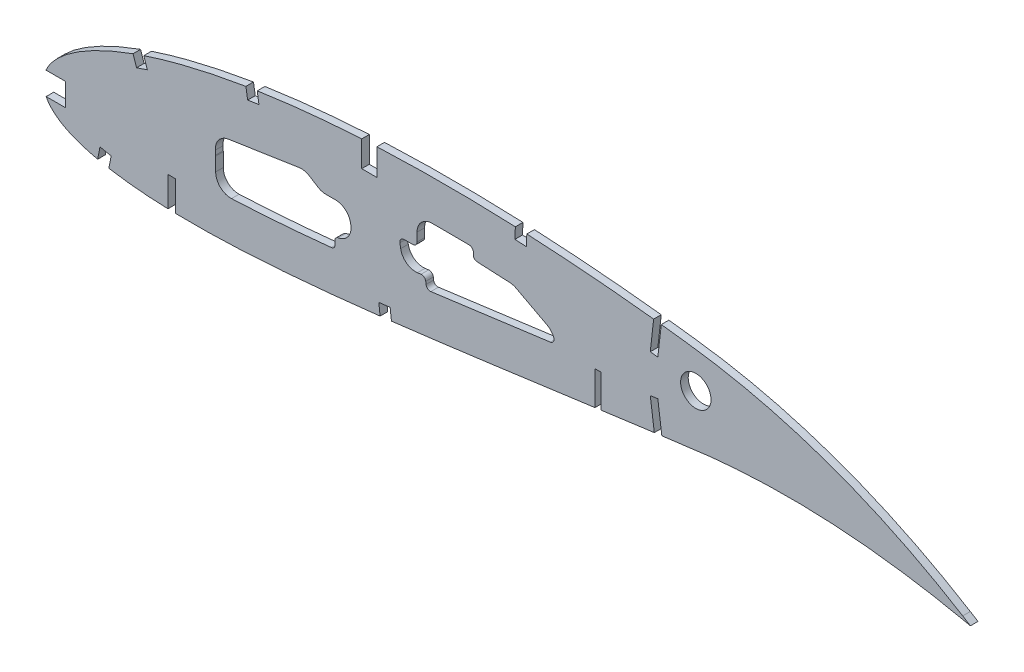
from build123d import *

# Parameters (mm, degrees)
BOSS_EXTRUDE1_DEPTH = 3.175
CUT_EXTRUDE1_DEPTH  = 7.62
SKETCH3_R           = 6.35
CUT_EXTRUDE2_DEPTH  = 7.62
SKETCH4_W           = 9.525
SKETCH4_H           = 9.525
CUT_EXTRUDE3_DEPTH  = 391.201801695
CUT_EXTRUDE4_DEPTH  = 7.62
FILLET1_START       = -1
FILLET1_DEPTH       = 5
FILLET1_2_DEPTH     = 3.175
FILLET2_R           = 1.778


with BuildPart() as part:
    # Sketch1 → Boss-Extrude1 (new body)
    with BuildSketch(Plane.XY):
        with BuildLine():
            Line((383.459719795, -0.598570683), (387.151098381, -1.385981683))
            Line((387.151098381, -1.385981683), (383.938576586, 0.598570683))
            add(Edge.make_bspline(
                [(383.938576586, 0.598570683), (383.909164402, 0.616740215), (383.791629853, 0.689347806), (383.526803342, 0.851788775), (383.085812234, 1.122342517), (382.46846306, 1.499129399), (381.675235414, 1.981149322), (380.705730092, 2.565026812), (379.560552258, 3.248864764), (378.239979352, 4.02942936), (376.744146546, 4.903065392), (375.073623444, 5.866233811), (373.228555337, 6.913481558), (371.209656947, 8.040529653), (369.017620878, 9.242017712), (366.652862008, 10.5125194), (364.116227136, 11.845572217), (361.408689747, 13.235442203), (358.530743662, 14.674454529), (355.483745734, 16.156620323), (352.268711027, 17.674549225), (348.886737002, 19.220143157), (345.339766501, 20.787101279), (341.62878015, 22.365681942), (337.755892849, 23.949045726), (333.722753433, 25.528181676), (329.531749722, 27.095897536), (325.184498663, 28.642037582), (320.684250026, 30.159844956), (316.03318694, 31.639459621), (311.234635387, 33.072845765), (306.291383411, 34.45071), (301.207551835, 35.76598594), (295.986364862, 37.009095199), (290.632247735, 38.171716814), (285.149456354, 39.246851106), (279.542589067, 40.223764407), (273.827182957, 41.101695037), (268.095197614, 41.831984573), (262.375005403, 42.548231339), (256.663331957, 43.221079634), (250.881849899, 43.865424929), (245.036121341, 44.477639467), (239.131944816, 45.055808842), (233.175297421, 45.597437688), (227.172369204, 46.100937725), (221.12896887, 46.563455864), (215.051468851, 46.984279591), (208.945877574, 47.359709224), (202.818698224, 47.689463037), (196.676150699, 47.971241104), (190.524627328, 48.20310193), (184.370660154, 48.383645908), (178.220637202, 48.511143259), (172.081217377, 48.584792389), (165.95878665, 48.602580967), (159.860000816, 48.564190717), (153.791246295, 48.468303513), (147.759185686, 48.313606629), (141.770214134, 48.099811437), (135.830807778, 47.827010592), (129.947469668, 47.492919603), (124.126582163, 47.099667535), (118.374627308, 46.64560247), (112.697924861, 46.1306036), (107.102424066, 45.556817635), (101.594354639, 44.922683996), (96.179619551, 44.23000695), (90.864141437, 43.480144639), (85.653884398, 42.672688505), (80.554429795, 41.809970933), (75.571281385, 40.892874577), (70.709711341, 39.924088059), (65.975012599, 38.903864189), (61.372197101, 37.835263284), (56.906048373, 36.72014713), (52.581367423, 35.560557176), (48.402538226, 34.359275924), (44.373786491, 33.11902871), (40.499808771, 31.84117832), (36.783532955, 30.530569775), (33.229524089, 29.188133497), (29.840504666, 27.818005118), (26.620446377, 26.422055375), (23.571754691, 25.004539962), (20.697880073, 23.567072571), (18.000870717, 22.113680535), (15.483434196, 20.646592482), (13.147993867, 19.168533315), (10.995531238, 17.683252327), (9.029014018, 16.191681681), (7.249117676, 14.697590602), (5.656968684, 13.203254087), (4.254842735, 11.709701653), (3.042689485, 10.219563342), (2.022097407, 8.734019375), (1.193243635, 7.254475378), (0.55800286, 5.78200614), (0.115745172, 4.317439731), (-0.126343705, 2.862937809), (-0.186601112, 1.417334332), (-0.062107432, 0.471738862), (0, 0)],
                knots=[0, 0, 0, 0, 0.00025409, 0.001015374, 0.002283359, 0.004056577, 0.006330982, 0.009105274, 0.01237449, 0.016134024, 0.020379661, 0.025105976, 0.030306237, 0.035972206, 0.042099523, 0.048678064, 0.055701664, 0.063160184, 0.071045824, 0.079349827, 0.08806291, 0.097175757, 0.106678112, 0.116561573, 0.126814276, 0.1374283, 0.148393618, 0.15969976, 0.171338126, 0.183297699, 0.195569604, 0.208143556, 0.221011594, 0.234161831, 0.247587451, 0.261276823, 0.27522271, 0.289414144, 0.3037712, 0.317689227, 0.331784111, 0.346039677, 0.36044387, 0.374982721, 0.389640455, 0.404403317, 0.419256601, 0.43418675, 0.449177265, 0.464214782, 0.479284009, 0.49436974, 0.509457833, 0.524532346, 0.53957932, 0.554582984, 0.569529546, 0.584403417, 0.599190992, 0.613876838, 0.628447475, 0.642888675, 0.657186054, 0.671325546, 0.685294014, 0.699078148, 0.712665095, 0.726042645, 0.739197713, 0.752117587, 0.764792042, 0.777208152, 0.789355685, 0.80122396, 0.812803686, 0.824082909, 0.835054602, 0.845709571, 0.856037853, 0.866033835, 0.875688843, 0.884997719, 0.893953426, 0.902552897, 0.910789386, 0.918660734, 0.926166253, 0.933302626, 0.94007122, 0.94647478, 0.952517526, 0.958204819, 0.963546652, 0.9685566, 0.973249913, 0.977651041, 0.981787043, 0.985694226, 0.989415109, 0.993001157, 0.996508416, 1, 1, 1, 1], degree=3))
            add(Edge.make_bspline(
                [(0, 0), (0.098594067, -0.465429756), (0.296235321, -1.398428295), (0.833200827, -2.741559621), (1.543312041, -4.032697891), (2.441472641, -5.268413507), (3.521710628, -6.448368806), (4.781640288, -7.573790979), (6.220025893, -8.64407503), (7.834984953, -9.658733762), (9.624171422, -10.618844355), (11.585574313, -11.523809795), (13.717405168, -12.373347376), (16.017341357, -13.166321391), (18.482571114, -13.903939589), (21.110750633, -14.584404413), (23.898891402, -15.208666937), (26.844311765, -15.775133676), (29.943802121, -16.284380139), (33.194142548, -16.736121271), (36.59199678, -17.130639725), (40.134031288, -17.46710754), (43.816742631, -17.74624851), (47.636460203, -17.96824782), (51.589476278, -18.133809384), (55.672004278, -18.242303834), (59.880045838, -18.295422597), (64.209798061, -18.293963098), (68.657025429, -18.237535039), (73.217928944, -18.129255696), (77.888131918, -17.96843911), (82.663418096, -17.757031491), (87.53948011, -17.497160264), (92.511944666, -17.189706447), (97.576435823, -16.836032634), (102.728556211, -16.438975174), (107.9636256, -15.999524359), (113.277078315, -15.52024171), (118.664210326, -15.003526584), (124.120367239, -14.4510143), (129.640733027, -13.865303885), (135.220390799, -13.248293384), (140.854593983, -12.603274503), (146.538195749, -11.931414237), (152.266389991, -11.236548635), (158.033787934, -10.52000534), (163.835566864, -9.784544171), (169.666508639, -9.033628137), (175.521154495, -8.267171513), (181.394580274, -7.490635069), (187.28112183, -6.703379195), (193.175655329, -5.90945278), (199.072724256, -5.111323575), (204.966584816, -4.309237241), (210.852056119, -3.506517822), (216.72367834, -2.705368887), (222.575700149, -1.905863728), (228.402826975, -1.111976133), (234.199191111, -0.323609112), (239.959447702, 0.457639018), (245.678076832, 1.229436212), (251.34968319, 1.990808513), (256.968416226, 2.741274105), (262.528623029, 3.481114832), (267.941468501, 4.187874758), (273.192808754, 4.89918891), (278.300339848, 5.482308989), (283.344275668, 5.980022849), (288.329855672, 6.388079628), (293.25109327, 6.712349854), (298.102349784, 6.95515067), (302.877843519, 7.119871856), (307.571542288, 7.211400107), (312.17758361, 7.232058132), (316.689680406, 7.188433969), (321.101964205, 7.084044048), (325.408277014, 6.923573954), (329.602611012, 6.712437706), (333.679008651, 6.45639092), (337.631349997, 6.159210609), (341.4541277, 5.827834534), (345.141443703, 5.46711367), (348.687636023, 5.081169316), (352.087530269, 4.678088588), (355.335684636, 4.260525247), (358.42721331, 3.835341496), (361.357139876, 3.406846029), (364.120823945, 2.98050952), (366.713923524, 2.560399127), (369.132249836, 2.152090859), (371.372014685, 1.759399564), (373.429331453, 1.386160167), (375.301346074, 1.037081953), (376.984361404, 0.713898906), (378.476126466, 0.421937235), (379.773867448, 0.162485176), (380.875681878, -0.060801967), (381.779645661, -0.247042835), (382.484385883, -0.393180216), (382.98851051, -0.499447588), (383.291474212, -0.56268208), (383.426084821, -0.591395979), (383.459719795, -0.598570683)],
                knots=[0, 0, 0, 0, 0.003638255, 0.007293231, 0.011028136, 0.014901081, 0.018963272, 0.023258475, 0.027820626, 0.032679082, 0.03785316, 0.043361875, 0.049214679, 0.055422346, 0.061988786, 0.068918036, 0.076211157, 0.083868392, 0.091887411, 0.100265912, 0.108999867, 0.11808453, 0.127514843, 0.13728527, 0.147387918, 0.157816481, 0.168563473, 0.179619128, 0.190977373, 0.202626974, 0.214560478, 0.226767249, 0.239236417, 0.251959004, 0.264923895, 0.278119703, 0.291536035, 0.30516028, 0.318980685, 0.332985499, 0.347162791, 0.361498603, 0.375980747, 0.390597192, 0.405332594, 0.420174823, 0.435109533, 0.450124276, 0.465203068, 0.480333154, 0.495500583, 0.510689775, 0.525887335, 0.541078314, 0.556247233, 0.571381785, 0.586466041, 0.601484516, 0.616424329, 0.631269423, 0.646006524, 0.660620684, 0.675098187, 0.689422858, 0.703581825, 0.716907564, 0.730009274, 0.742952128, 0.755725558, 0.768319952, 0.780724338, 0.792926529, 0.804916041, 0.816679084, 0.828203524, 0.839474901, 0.850481359, 0.861207697, 0.871639326, 0.881763414, 0.891563605, 0.901027365, 0.910138977, 0.918883977, 0.927249278, 0.935221104, 0.942784739, 0.949928188, 0.956638465, 0.962904204, 0.968712288, 0.974054485, 0.978918432, 0.983297218, 0.987180246, 0.990560675, 0.993433358, 0.995790626, 0.997629588, 0.998945816, 0.999736593, 1, 1, 1, 1], degree=3))
        make_face()
    extrude(amount=BOSS_EXTRUDE1_DEPTH)

    # Sketch2 → Cut-Extrude1 (cut)
    with BuildSketch(Plane(origin=(0, 0, 0), x_dir=(-1, 0, 0), z_dir=(0, 0, -1))):
        Polygon((-232.830519521, 13.223759895), (-230.290519521, 13.223759895), (-230.290519521, -0.503150855), (-230.290519521, -1.676443335), (-232.830519521, -2.849735815), (-232.830519521, -0.503150855), align=None)
        Polygon((-139.168019522, 47.908228591), (-139.168019522, 36.867770555), (-132.818019522, 36.867770555), (-132.818019522, 47.908228591), (-132.818019522, 49.167930893), (-139.168019522, 49.448896734), align=None)
        Polygon((-55.030519521, -5.682926751), (-55.030519521, -17.79896551), (-55.030519521, -19.968015046), (-51.855519521, -18.501399447), (-51.855519521, -17.79896551), (-51.855519521, -5.682926751), align=None)
    extrude(amount=-CUT_EXTRUDE1_DEPTH, mode=Mode.SUBTRACT)

    # Sketch3 → Cut-Extrude2 (cut)
    with BuildSketch(Plane(origin=(0, 0, 0), x_dir=(-1, 0, 0), z_dir=(0, 0, -1))):
        with Locations((-272.41988512, 26.255421435)):
            Circle(SKETCH3_R)
    extrude(amount=-CUT_EXTRUDE2_DEPTH, mode=Mode.SUBTRACT)

    # Sketch4 → Cut-Extrude3 (cut, through all)
    with BuildSketch(Plane.XY.offset(3.175)):
        Polygon((253.397809127, 15.056343838), (255.078462926, 2.468039866), (255.321300376, 0.649157456), (258.468376369, 1.069320906), (258.221392489, 2.887160921), (256.54488512, 15.476507288), align=None)
        Polygon((254.808096953, 43.520883098), (253.389754363, 30.90036007), (256.54488512, 30.545774422), (258.006893428, 43.155681595), align=None)
        Polygon((197.024533439, 48.031874652), (196.820007584, 43.287239598), (201.576703663, 43.055240554), (201.812278612, 47.809990002), align=None)
        Polygon((84.402266277, 42.549858688), (85.17169337, 37.877948881), (89.879557048, 38.597184279), (89.159820037, 43.308449986), align=None)
        Polygon((139.959133713, -7.933102126), (140.50780968, -12.664676911), (145.25037982, -12.107361904), (144.688452723, -7.371904786), align=None)
        with BuildLine():
            Line((37.231412813, 30.804890111), (38.732017385, 26.341405569))
            Line((38.732017385, 26.341405569), (43.246204563, 27.858913762))
            Line((43.246204563, 27.858913762), (41.730976668, 32.366581455))
            add(Edge.make_bspline(
                [(41.730976668, 32.366581455), (41.319292858, 32.228852273), (39.815138692, 31.720676208), (38.316642672, 31.195897645), (37.231412813, 30.804890111)],
                knots=[0, 0, 0, 0, 0.273427544, 1, 1, 1, 1], degree=3))
        make_face()
        Polygon((23.468316016, -9.93675194), (22.544568436, -14.611612681), (21.604441445, -19.369365619), (26.270689814, -20.291411404), (27.186578871, -15.647384666), (28.135838832, -10.859775904), align=None)
        with Locations((4.341695506, 1.80600836)):
            Rectangle(SKETCH4_W, SKETCH4_H)
    extrude(amount=-CUT_EXTRUDE3_DEPTH, mode=Mode.SUBTRACT)

    # Sketch5 → Cut-Extrude4 (cut)
    with BuildSketch(Plane.XY.offset(3.175)):
        with BuildLine():
            Line((127.247206918, 20.103770555), (116.054019522, 20.103770555))
            Line((116.054019522, 20.103770555), (108.982936673, 24.557164133))
            Line((108.982936673, 24.557164133), (71.323233405, 18.803770758))
            Line((71.323233405, 18.803770758), (71.794519521, 11.081073249))
            Line((71.794519521, 11.081073249), (71.794519521, -1.390887248))
            add(Edge.make_bspline(
                [(71.794519521, -1.390887248), (75.954824437, -1.278683502), (84.256386612, -0.930505954), (96.787974565, -0.116679028), (109.334652646, 0.927450993), (117.722967624, 1.745813325), (121.910290026, 2.178170172)],
                knots=[0.147972334, 0.147972334, 0.147972334, 0.147972334, 0.324510103, 0.501047871, 0.67758564, 0.854123408, 0.854123408, 0.854123408, 0.854123408], degree=3))
            Line((121.910290026, 2.178170172), (121.380839985, 6.743947815))
            Line((121.380839985, 6.743947815), (129.423910419, 7.698366353))
            Line((129.423910419, 7.698366353), (127.247206918, 20.103770555))
        make_face()
        with BuildLine():
            Line((150.138794263, 10.156466069), (159.360237965, 11.250714452))
            Line((159.360237965, 11.250714452), (159.910209934, 6.616005275))
            add(Edge.make_bspline(
                [(159.910209934, 6.616005275), (164.374628949, 7.183283311), (173.296140213, 8.34080209), (186.698004533, 10.129243984), (200.106359162, 11.946008858), (209.05396088, 13.167552406), (213.526519521, 13.778163536)],
                knots=[0.142323042, 0.142323042, 0.142323042, 0.142323042, 0.325944988, 0.509566934, 0.693188881, 0.876810827, 0.876810827, 0.876810827, 0.876810827], degree=3))
            Line((213.526519521, 13.778163536), (213.526519521, 17.323998281))
            Line((213.526519521, 17.323998281), (196.085617333, 26.539130697))
            Line((196.085617333, 26.539130697), (179.353660838, 27.355200893))
            Line((179.353660838, 27.355200893), (179.541495349, 31.712626548))
            add(Edge.make_bspline(
                [(179.541495349, 31.712626548), (177.572940232, 31.749425155), (173.634823607, 31.806093091), (167.731144174, 31.838751925), (161.828749391, 31.817925884), (157.897781575, 31.767244659), (155.932019522, 31.732357881)],
                knots=[0.237663614, 0.237663614, 0.237663614, 0.237663614, 0.371263462, 0.504863309, 0.638463157, 0.772063004, 0.772063004, 0.772063004, 0.772063004], degree=3))
            Line((155.932019522, 31.732357881), (155.932019522, 20.103770555))
            Line((155.932019522, 20.103770555), (148.3933991, 20.103770555))
            Line((148.3933991, 20.103770555), (150.138794263, 10.156466069))
        make_face()
    extrude(amount=-CUT_EXTRUDE4_DEPTH, mode=Mode.SUBTRACT)

    # Fillet1: read off the stored shape, not the designer's step
    # Fillet1 outline → Fillet1 (cut)
    with BuildSketch(Plane.XY.offset(FILLET1_START)):
        with BuildLine():
            Line((71.794519521, 11.081073249), (71.782728159, 11.274291601))
            ThreePointArc((71.782728159, 11.274291601), (71.791570996, 11.080983365), (71.794519521, 10.887495442))
            Line((71.794519521, 10.887495442), (71.794519521, 11.081073249))
        make_face()
        with BuildLine():
            Line((116.054019522, 20.103770555), (117.887025266, 20.103770555))
            ThreePointArc((117.887025266, 20.103770555), (116.125924299, 20.352867066), (114.502991554, 21.080613585))
            Line((114.502991554, 21.080613585), (116.054019522, 20.103770555))
        make_face()
    extrude(amount=FILLET1_DEPTH, mode=Mode.SUBTRACT)

    # Fillet1 2 outline → Fillet1 2 (add)
    with BuildSketch(Plane.XY):
        with BuildLine():
            Line((150.138794263, 10.156466069), (156.103441667, 10.864251746))
            ThreePointArc((156.103441667, 10.864251746), (151.56556203, 12.074787217), (149.100728536, 16.072579554))
            Line((149.100728536, 16.072579554), (150.138794263, 10.156466069))
        make_face()
        with BuildLine():
            Line((155.932019522, 31.732357881), (155.932019522, 25.462096816))
            ThreePointArc((155.932019522, 25.462096816), (157.774934753, 29.935203889), (162.233968149, 31.811915007))
            add(Edge.make_bspline(
                [(162.233968149, 31.811915007), (162.099220916, 31.810895326), (159.997935798, 31.79432155), (157.897781575, 31.767244659), (155.932019522, 31.732357881)],
                knots=[0.629309211, 0.629309211, 0.629309211, 0.629309211, 0.638463157, 0.772063004, 0.772063004, 0.772063004, 0.772063004], degree=3))
        make_face()
        with BuildLine():
            ThreePointArc((194.676156631, 26.607874533), (196.044686193, 26.389729945), (197.333302923, 25.879899437))
            Line((197.333302923, 25.879899437), (196.085617333, 26.539130697))
            Line((196.085617333, 26.539130697), (194.676156631, 26.607874533))
        make_face()
        with BuildLine():
            ThreePointArc((210.149374692, 19.108357625), (212.546871184, 16.892426079), (213.526519521, 13.778163536))
            Line((213.526519521, 13.778163536), (213.526519521, 17.323998281))
            Line((213.526519521, 17.323998281), (210.149374692, 19.108357625))
        make_face()
        with BuildLine():
            Line((129.423910419, 7.698366353), (128.263717798, 14.310501821))
            ThreePointArc((128.263717798, 14.310501821), (127.104491851, 9.423453758), (122.757531088, 6.90731074))
            Line((122.757531088, 6.90731074), (129.423910419, 7.698366353))
        make_face()
        with BuildLine():
            ThreePointArc((78.410283323, -1.162080372), (73.749357416, 0.599229072), (71.794519521, 5.182355742))
            Line((71.794519521, 5.182355742), (71.794519521, -1.390887248))
            add(Edge.make_bspline(
                [(71.794519521, -1.390887248), (74.001322952, -1.331369588), (76.205446669, -1.254439371), (78.410283323, -1.162080372)],
                knots=[0.147972334, 0.147972334, 0.147972334, 0.147972334, 0.241615507, 0.241615507, 0.241615507, 0.241615507], degree=3))
        make_face()
        with BuildLine():
            ThreePointArc((71.676464648, 13.015571304), (73.073584312, 17.390868404), (77.055690084, 19.679536508))
            Line((77.055690084, 19.679536508), (71.323233405, 18.803770758))
            Line((71.323233405, 18.803770758), (71.676464648, 13.015571304))
        make_face()
        with BuildLine():
            ThreePointArc((106.64292908, 24.199673685), (108.895947425, 24.139254036), (110.985945994, 23.295661611))
            Line((110.985945994, 23.295661611), (108.982936673, 24.557164133))
            Line((108.982936673, 24.557164133), (106.64292908, 24.199673685))
        make_face()
        with BuildLine():
            ThreePointArc((121.914394355, 20.103770555), (125.998130947, 18.616444248), (128.168844275, 14.851202192))
            Line((128.168844275, 14.851202192), (127.247206918, 20.103770555))
            Line((127.247206918, 20.103770555), (121.914394355, 20.103770555))
        make_face()
    extrude(amount=FILLET1_2_DEPTH)

    # Fillet2
    fillet2_edges = [part.edges().sort_by_distance(p)[0] for p in [
        (213.526519521, 13.778163536, 1.5875),
        (179.353660838, 27.355200893, 1.5875),
        (179.541495349, 31.712626548, 1.5875),
        (159.910209934, 6.616005275, 1.5875),
        (159.360237965, 11.250714452, 1.5875),
        (155.932019522, 20.103770555, 1.5875),
        (148.3933991, 20.103770555, 1.5875),
        (121.910290026, 2.178170172, 1.5875),
        (121.380839985, 6.743947815, 1.5875),
    ]]
    fillet(fillet2_edges, radius=FILLET2_R)


solid = part.part
